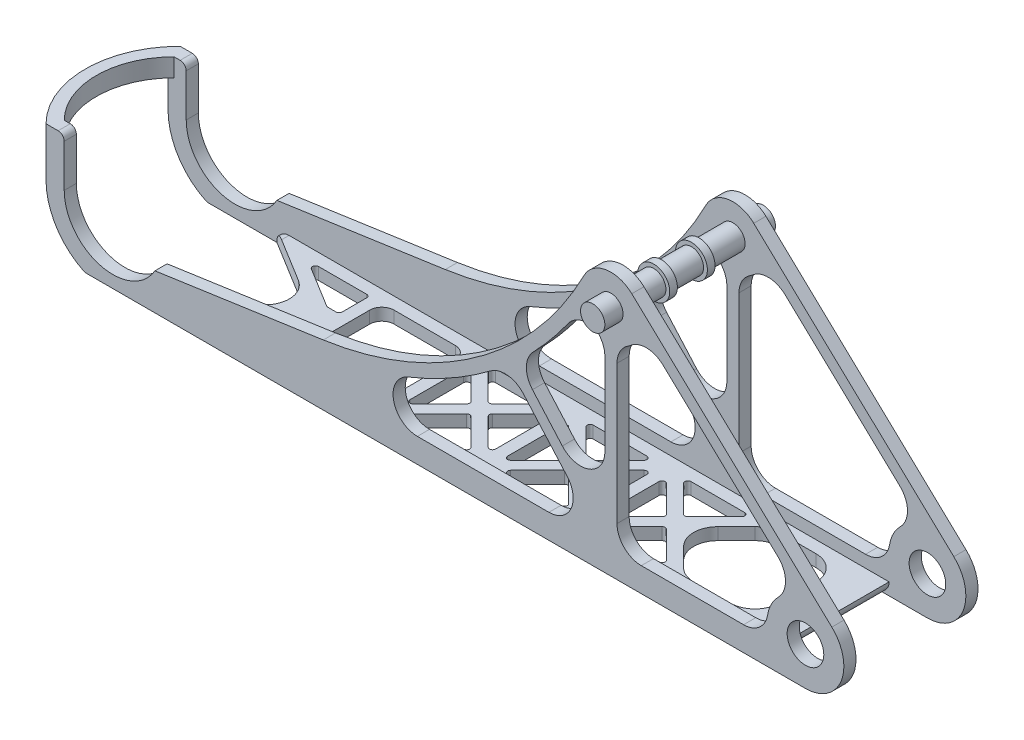
from build123d import *

# Parameters (mm, degrees)
SKETCH2_R            = 7.9375
SKETCH2_R_2          = 3.175
SKETCH2_R_3          = 10.033
BOSS_EXTRUDE1_DEPTH  = 3.175
SKETCH3_W            = 159.943477372
SKETCH3_H            = 3.175
BOSS_EXTRUDE2_DEPTH  = 17.526
FILLET1_R            = 3.175
CUT_EXTRUDE3_DEPTH   = 218.74804909
CUT_EXTRUDE2_DEPTH   = 222.832006327
FILLET5_START        = -17.526
FILLET5_DEPTH        = 3.175
FILLET5_START_2      = 14.351
FILLET5_2_DEPTH      = 3.175
SKETCH6_R            = 3.175
BOSS_EXTRUDE3_DEPTH  = 22.2885
BOSS_EXTRUDE4_DEPTH  = 3.175
FILLET6_R            = 1.5875
FILLET6_OF_MIRROR5_R = 1.5875
FILLET7_R            = 0.79375
FILLET8_R            = 0.79375
FILLET10_R           = 6.35
SKETCH9_W            = 1.5875
SKETCH9_H            = 3.175
BOSS_EXTRUDE5_DEPTH  = 4.7625
CUT_EXTRUDE4_DEPTH   = 219.183018218
SKETCH11_R           = 4.7879
CUT_EXTRUDE5_DEPTH   = 223.634208372
SKETCH12_R           = 4.175
SKETCH12_R_2         = 3.175
BOSS_EXTRUDE6_DEPTH  = 1
BOSS_EXTRUDE7_START  = -9.8425
SKETCH12_2_R         = 4.175
SKETCH12_2_R_2       = 3.175
BOSS_EXTRUDE7_DEPTH  = 1


with BuildPart() as part:
    # Sketch2 → Boss-Extrude1 (new body)
    # profile 1 of 3: a face of its own
    with BuildSketch(Plane.XY.offset(17.526)):
        with BuildLine():
            Line((203.734571541, 20.506202772), (151.468405055, 69.810144243))
            ThreePointArc((151.468405055, 69.810144243), (153.309984981, 67.180377869), (153.959250355, 64.036249645))
            ThreePointArc((153.959250355, 64.036249645), (144.157475429, 56.320785612), (138.959972181, 67.660500641))
            ThreePointArc((138.959972181, 67.660500641), (110.818436746, 35.084174324), (70.86761314, 19.05))
            Line((70.86761314, 19.05), (26.873522628, 12.7))
            ThreePointArc((26.873522628, 12.7), (12.587998127, 6.782742006), (3.175, 19.05))
            Line((3.175, 19.05), (3.175, 30.1625))
            ThreePointArc((3.175, 30.1625), (1.5875, 31.75), (0, 30.1625))
            Line((0, 30.1625), (0, 19.05))
            ThreePointArc((0, 19.05), (4.649679849, 7.824679849), (15.875, 3.175))
            Line((15.875, 3.175), (196.85, 3.175))
            ThreePointArc((196.85, 3.175), (187.525731733, 16.911931734), (203.734571541, 20.506202772))
        make_face()
    # profile 2 of 3: a face of its own
    with BuildSketch(Plane.XY.offset(17.526)):
        with Locations((146.021750355, 64.036249645)):
            Circle(SKETCH2_R)
        with Locations((146.021750355, 64.036249645)):
            Circle(SKETCH2_R_2, mode=Mode.SUBTRACT)
    # profile 3 of 3: a face of its own
    with BuildSketch(Plane.XY.offset(17.526)):
        with Locations((196.85, 13.208)):
            Circle(SKETCH2_R_3)
        with Locations((196.85, 13.208)):
            Circle(SKETCH2_R_2, mode=Mode.SUBTRACT)
    boss_extrude1 = extrude(amount=-BOSS_EXTRUDE1_DEPTH)

    # Sketch3 → Boss-Extrude2 (add)
    with BuildSketch(Plane.XY.offset(17.526)):
        with Locations((106.845261314, 4.7625)):
            Rectangle(SKETCH3_W, SKETCH3_H)
    boss_extrude2 = extrude(amount=-BOSS_EXTRUDE2_DEPTH)

    # Mirror1: Boss-Extrude1, Boss-Extrude2 across plane
    add(boss_extrude1.mirror(Plane.XY))
    add(boss_extrude2.mirror(Plane.XY))

    # Fillet1
    fillet1_edges = [part.edges().sort_by_distance(p)[0] for p in [
        (26.873522628, 6.35, 0),
        (186.817, 3.175, 0),
    ]]
    fillet(fillet1_edges, radius=FILLET1_R - 0.0001)  # a hair under: the kernel refuses the full size

    # Sketch4 → Cut-Extrude3 (cut, through all)
    with BuildSketch(Plane(origin=(0, 6.35, 0), x_dir=(1, 0, 0), z_dir=(0, 1, 0))):
        with BuildLine():
            Line((41.424338906, 5.410293046), (26.873522628, 14.351))
            Line((26.873522628, 14.351), (26.873522628, -14.351))
            Line((26.873522628, -14.351), (41.424338906, -5.410293046))
            ThreePointArc((41.424338906, -5.410293046), (44.45, 0), (41.424338906, 5.410293046))
        make_face()
        Polygon((51.126971921, -3.175), (38.105509342, -11.176), (54.301971921, -11.176), (54.301971921, -3.175), align=None)
        Polygon((54.301971921, 3.175), (54.301971921, 11.176), (38.105509342, 11.176), (51.126971921, 3.175), align=None)
        Polygon((68.652971921, -2.24506403), (59.722035952, -11.176), (77.583907891, -11.176), align=None)
        Polygon((57.476971921, 8.93093597), (57.476971921, -8.93093597), (66.407907891, 0), align=None)
        Polygon((79.828971921, 8.93093597), (70.898035952, 0), (79.828971921, -8.93093597), align=None)
        Polygon((59.722035952, 11.176), (68.652971921, 2.24506403), (77.583907891, 11.176), align=None)
        Polygon((94.179971921, -2.24506403), (85.249035952, -11.176), (103.110907891, -11.176), align=None)
        Polygon((83.003971921, 8.93093597), (83.003971921, -8.93093597), (91.934907891, 0), align=None)
        Polygon((105.355971921, 8.93093597), (96.425035952, 0), (105.355971921, -8.93093597), align=None)
        Polygon((85.249035952, 11.176), (94.179971921, 2.24506403), (103.110907891, 11.176), align=None)
        Polygon((119.706971921, -2.24506403), (110.776035952, -11.176), (128.637907891, -11.176), align=None)
        Polygon((108.530971921, 8.93093597), (108.530971921, -8.93093597), (117.461907891, 0), align=None)
        Polygon((130.882971921, 8.93093597), (121.952035952, 0), (130.882971921, -8.93093597), align=None)
        Polygon((110.776035952, 11.176), (119.706971921, 2.24506403), (128.637907891, 11.176), align=None)
        Polygon((145.233971921, -2.24506403), (136.303035952, -11.176), (154.164907891, -11.176), align=None)
        Polygon((134.057971921, 8.93093597), (134.057971921, -8.93093597), (142.988907891, 0), align=None)
        Polygon((158.655035952, 11.176), (147.479035952, 0), (158.655035952, -11.176), (177.292, -11.176), (177.292, 11.176), (161.830035952, 11.176), align=None)
        Polygon((136.303035952, 11.176), (145.233971921, 2.24506403), (154.164907891, 11.176), align=None)
    extrude(amount=-CUT_EXTRUDE3_DEPTH, mode=Mode.SUBTRACT)

    # Sketch5 → Cut-Extrude2 (cut, through all)
    with BuildSketch(Plane.XY.offset(17.526)):
        with BuildLine():
            Line((71.321184569, 15.907564963), (27.327094057, 9.557564963))
            Line((27.327094057, 9.557564963), (27.101477372, 9.525))
            Line((27.101477372, 9.525), (143.903046849, 9.525))
            Line((143.903046849, 9.525), (119.1289989, 37.554516736))
            ThreePointArc((119.1289989, 37.554516736), (96.760430289, 23.340208677), (71.321184569, 15.907564963))
        make_face()
        with BuildLine():
            ThreePointArc((138.776352339, 60.794627545), (130.910536695, 49.598167061), (121.507959659, 39.657174747))
            Line((121.507959659, 39.657174747), (144.434250355, 13.718222416))
            Line((144.434250355, 13.718222416), (144.434250355, 56.098749645))
            Line((144.434250355, 56.098749645), (144.434250355, 56.259119712))
            ThreePointArc((144.434250355, 56.259119712), (141.057102365, 57.843013287), (138.776352339, 60.794627545))
        make_face()
        with BuildLine():
            Line((147.609250355, 56.098749645), (147.609250355, 9.525))
            Line((147.609250355, 9.525), (187.51744408, 9.525))
            ThreePointArc((187.51744408, 9.525), (188.384235513, 18.592414607), (196.228885591, 23.221755833))
            Line((196.228885591, 23.221755833), (153.908858853, 63.143262644))
            ThreePointArc((153.908858853, 63.143262644), (151.877508848, 58.677705186), (147.609250355, 56.259119712))
            Line((147.609250355, 56.259119712), (147.609250355, 56.098749645))
        make_face()
    extrude(amount=-CUT_EXTRUDE2_DEPTH, mode=Mode.SUBTRACT)

    # Fillet5: read off the stored shape, not the designer's step
    # Fillet5 outline → Fillet5 (add)
    with BuildSketch(Plane.XY.offset(FILLET5_START)):
        with BuildLine():
            ThreePointArc((189.644321723, 29.433134501), (191.636406424, 24.900691806), (189.768781699, 20.315561914))
            ThreePointArc((189.768781699, 20.315561914), (192.733815715, 22.35776043), (196.228885591, 23.221755833))
            Line((196.228885591, 23.221755833), (189.644321723, 29.433134501))
        make_face()
        with BuildLine():
            ThreePointArc((187.51744408, 9.525), (186.873503206, 12.144702895), (186.95083395, 14.84127907))
            ThreePointArc((186.95083395, 14.84127907), (184.793967641, 11.033170392), (180.685538982, 9.525))
            Line((180.685538982, 9.525), (187.51744408, 9.525))
        make_face()
        with BuildLine():
            ThreePointArc((151.154709084, 57.981776842), (155.429422991, 59.485966656), (159.618399828, 57.757314277))
            Line((159.618399828, 57.757314277), (153.908858853, 63.143262644))
            ThreePointArc((153.908858853, 63.143262644), (153.024662005, 60.299521842), (151.154709084, 57.981776842))
        make_face()
        with BuildLine():
            Line((147.609250355, 9.525), (153.959250355, 9.525))
            ThreePointArc((153.959250355, 9.525), (149.469122294, 11.384871939), (147.609250355, 15.875))
            Line((147.609250355, 15.875), (147.609250355, 9.525))
        make_face()
        with BuildLine():
            ThreePointArc((147.609250355, 52.156487442), (148.359076746, 55.149906149), (150.431472577, 57.436381755))
            ThreePointArc((150.431472577, 57.436381755), (149.077589859, 56.710558471), (147.609250355, 56.259119712))
            Line((147.609250355, 56.259119712), (147.609250355, 52.156487442))
        make_face()
        with BuildLine():
            ThreePointArc((142.109076345, 57.068032591), (143.823594613, 54.873549731), (144.434250355, 52.156487442))
            Line((144.434250355, 52.156487442), (144.434250355, 56.259119712))
            ThreePointArc((144.434250355, 56.259119712), (141.057102365, 57.843013287), (138.776352339, 60.794627545))
            ThreePointArc((138.776352339, 60.794627545), (136.860812198, 57.732402808), (134.829468579, 54.745739541))
            ThreePointArc((134.829468579, 54.745739541), (138.080885233, 57.124349421), (142.109076345, 57.068032591))
        make_face()
        with BuildLine():
            Line((144.434250355, 13.718222416), (144.434250355, 30.491112082))
            ThreePointArc((144.434250355, 30.491112082), (140.33254953, 24.552454758), (133.326328838, 26.285796061))
            Line((133.326328838, 26.285796061), (144.434250355, 13.718222416))
        make_face()
        with BuildLine():
            ThreePointArc((125.514629062, 35.124003288), (123.924104407, 39.469787111), (125.705290835, 43.740967349))
            ThreePointArc((125.705290835, 43.740967349), (123.638316734, 41.666498466), (121.507959659, 39.657174747))
            Line((121.507959659, 39.657174747), (125.514629062, 35.124003288))
        make_face()
        with BuildLine():
            Line((143.903046849, 9.525), (134.573670689, 20.080316021))
            ThreePointArc((134.573670689, 20.080316021), (135.60480163, 13.265522728), (129.815749172, 9.525))
            Line((129.815749172, 9.525), (143.903046849, 9.525))
        make_face()
        with BuildLine():
            ThreePointArc((114.560542257, 33.890617868), (119.018173068, 35.133651766), (123.135668303, 33.021345277))
            Line((123.135668303, 33.021345277), (119.1289989, 37.554516736))
            ThreePointArc((119.1289989, 37.554516736), (116.873203561, 35.687114672), (114.560542257, 33.890617868))
        make_face()
        with BuildLine():
            Line((27.101477372, 9.525), (95.448030317, 9.525))
            ThreePointArc((95.448030317, 9.525), (89.21393407, 14.667298055), (93.076713731, 21.765616067))
            ThreePointArc((93.076713731, 21.765616067), (82.374433252, 18.184880685), (71.321184569, 15.907564963))
            Line((71.321184569, 15.907564963), (27.101477372, 9.525))
        make_face()
    extrude(amount=FILLET5_DEPTH)

    # Fillet5 2 outline → Fillet5 2 (add)
    with BuildSketch(Plane.XY.offset(FILLET5_START_2)):
        with BuildLine():
            ThreePointArc((189.644321723, 29.433134501), (191.636406424, 24.900691806), (189.768781699, 20.315561914))
            ThreePointArc((189.768781699, 20.315561914), (192.733815715, 22.35776043), (196.228885591, 23.221755833))
            Line((196.228885591, 23.221755833), (189.644321723, 29.433134501))
        make_face()
        with BuildLine():
            ThreePointArc((187.51744408, 9.525), (186.873503206, 12.144702895), (186.95083395, 14.84127907))
            ThreePointArc((186.95083395, 14.84127907), (184.793967641, 11.033170392), (180.685538982, 9.525))
            Line((180.685538982, 9.525), (187.51744408, 9.525))
        make_face()
        with BuildLine():
            ThreePointArc((151.154709084, 57.981776842), (155.429422991, 59.485966656), (159.618399828, 57.757314277))
            Line((159.618399828, 57.757314277), (153.908858853, 63.143262644))
            ThreePointArc((153.908858853, 63.143262644), (153.024662005, 60.299521842), (151.154709084, 57.981776842))
        make_face()
        with BuildLine():
            Line((147.609250355, 9.525), (153.959250355, 9.525))
            ThreePointArc((153.959250355, 9.525), (149.469122294, 11.384871939), (147.609250355, 15.875))
            Line((147.609250355, 15.875), (147.609250355, 9.525))
        make_face()
        with BuildLine():
            ThreePointArc((147.609250355, 52.156487442), (148.359076746, 55.149906149), (150.431472577, 57.436381755))
            ThreePointArc((150.431472577, 57.436381755), (149.077589859, 56.710558471), (147.609250355, 56.259119712))
            Line((147.609250355, 56.259119712), (147.609250355, 52.156487442))
        make_face()
        with BuildLine():
            ThreePointArc((142.109076345, 57.068032591), (143.823594613, 54.873549731), (144.434250355, 52.156487442))
            Line((144.434250355, 52.156487442), (144.434250355, 56.259119712))
            ThreePointArc((144.434250355, 56.259119712), (141.057102365, 57.843013287), (138.776352339, 60.794627545))
            ThreePointArc((138.776352339, 60.794627545), (136.860812198, 57.732402808), (134.829468579, 54.745739541))
            ThreePointArc((134.829468579, 54.745739541), (138.080885233, 57.124349421), (142.109076345, 57.068032591))
        make_face()
        with BuildLine():
            Line((144.434250355, 13.718222416), (144.434250355, 30.491112082))
            ThreePointArc((144.434250355, 30.491112082), (140.33254953, 24.552454758), (133.326328838, 26.285796061))
            Line((133.326328838, 26.285796061), (144.434250355, 13.718222416))
        make_face()
        with BuildLine():
            ThreePointArc((125.514629062, 35.124003288), (123.924104407, 39.469787111), (125.705290835, 43.740967349))
            ThreePointArc((125.705290835, 43.740967349), (123.638316734, 41.666498466), (121.507959659, 39.657174747))
            Line((121.507959659, 39.657174747), (125.514629062, 35.124003288))
        make_face()
        with BuildLine():
            Line((143.903046849, 9.525), (134.573670689, 20.080316021))
            ThreePointArc((134.573670689, 20.080316021), (135.60480163, 13.265522728), (129.815749172, 9.525))
            Line((129.815749172, 9.525), (143.903046849, 9.525))
        make_face()
        with BuildLine():
            ThreePointArc((114.560542257, 33.890617868), (119.018173068, 35.133651766), (123.135668303, 33.021345277))
            Line((123.135668303, 33.021345277), (119.1289989, 37.554516736))
            ThreePointArc((119.1289989, 37.554516736), (116.873203561, 35.687114672), (114.560542257, 33.890617868))
        make_face()
        with BuildLine():
            Line((27.101477372, 9.525), (95.448030317, 9.525))
            ThreePointArc((95.448030317, 9.525), (89.21393407, 14.667298055), (93.076713731, 21.765616067))
            ThreePointArc((93.076713731, 21.765616067), (82.374433252, 18.184880685), (71.321184569, 15.907564963))
            Line((71.321184569, 15.907564963), (27.101477372, 9.525))
        make_face()
    extrude(amount=FILLET5_2_DEPTH)

    # Sketch6 → Boss-Extrude3 (add)
    with BuildSketch(Plane.XY.offset(22.2885)):
        with Locations((146.021750355, 64.036249645)):
            Circle(SKETCH6_R)
    boss_extrude3 = extrude(amount=-BOSS_EXTRUDE3_DEPTH)

    # Mirror2: Boss-Extrude3 across plane
    add(boss_extrude3.mirror(Plane.XY))

    # Sketch8 → Boss-Extrude4 (add)
    with BuildSketch(Plane(origin=(0, 0, -17.526), x_dir=(-1, 0, 0), z_dir=(0, 0, -1))):
        with BuildLine():
            Line((-1.5875, 31.75), (1.5875, 31.75))
            Line((1.5875, 31.75), (1.5875, 30.1625))
            Line((1.5875, 30.1625), (1.5875, 19.05))
            ThreePointArc((1.5875, 19.05), (-1.178473526, 9.61861538), (-8.600161084, 3.175))
            Line((-8.600161084, 3.175), (-15.875, 3.175))
            ThreePointArc((-15.875, 3.175), (-4.649679849, 7.824679849), (0, 19.05))
            Line((0, 19.05), (0, 30.1625))
            ThreePointArc((0, 30.1625), (-0.464967985, 31.285032015), (-1.5875, 31.75))
        make_face()
    boss_extrude4 = extrude(amount=-BOSS_EXTRUDE4_DEPTH)

    # Fillet6
    fillet6_edges = [part.edges().sort_by_distance(p)[0] for p in [
        (-1.5875, 31.75, -15.9385),
        (8.600161084, 3.175, -15.9385),
    ]]
    fillet(fillet6_edges, radius=FILLET6_R)

    # Mirror5: Boss-Extrude4 across plane
    add(boss_extrude4.mirror(Plane.XY))

    # Fillet6 of Mirror5
    fillet6_of_mirror5_edges = [part.edges().sort_by_distance(p)[0] for p in [
        (-1.5875, 31.75, 15.9385),
        (8.600161084, 3.175, 15.9385),
    ]]
    fillet(fillet6_of_mirror5_edges, radius=FILLET6_OF_MIRROR5_R)

    # Fillet7
    fillet7_edges = [part.edges().sort_by_distance(p)[0] for p in [
        (51.126971921, 4.7625, 3.175),
        (54.301971921, 4.7625, 3.175),
        (54.301971921, 4.7625, 11.176),
        (38.105509342, 4.7625, 11.176),
        (54.301971921, 4.7625, -3.175),
        (51.126971921, 4.7625, -3.175),
        (38.105509342, 4.7625, -11.176),
        (54.301971921, 4.7625, -11.176),
    ]]
    fillet(fillet7_edges, radius=FILLET7_R)

    # Fillet8
    fillet8_edges = [part.edges().sort_by_distance(p)[0] for p in [
        (94.179971921, 4.7625, -2.24506403),
        (85.249035952, 4.7625, -11.176),
        (103.110907891, 4.7625, -11.176),
        (96.425035952, 4.7625, 0),
        (105.355971921, 4.7625, -8.93093597),
        (105.355971921, 4.7625, 8.93093597),
        (108.530971921, 4.7625, 8.93093597),
        (108.530971921, 4.7625, -8.93093597),
        (110.776035952, 4.7625, 11.176),
        (119.706971921, 4.7625, 2.24506403),
        (128.637907891, 4.7625, 11.176),
        (121.952035952, 4.7625, 0),
        (130.882971921, 4.7625, -8.93093597),
        (130.882971921, 4.7625, 8.93093597),
        (119.706971921, 4.7625, -2.24506403),
        (110.776035952, 4.7625, -11.176),
        (128.637907891, 4.7625, -11.176),
        (145.233971921, 4.7625, -2.24506403),
        (136.303035952, 4.7625, -11.176),
        (154.164907891, 4.7625, -11.176),
        (136.303035952, 4.7625, 11.176),
        (145.233971921, 4.7625, 2.24506403),
        (154.164907891, 4.7625, 11.176),
        (68.652971921, 4.7625, 2.24506403),
        (77.583907891, 4.7625, 11.176),
        (59.722035952, 4.7625, 11.176),
        (57.476971921, 4.7625, 8.93093597),
        (57.476971921, 4.7625, -8.93093597),
        (66.407907891, 4.7625, 0),
        (59.722035952, 4.7625, -11.176),
        (77.583907891, 4.7625, -11.176),
        (68.652971921, 4.7625, -2.24506403),
        (70.898035952, 4.7625, 0),
        (79.828971921, 4.7625, -8.93093597),
        (79.828971921, 4.7625, 8.93093597),
        (85.249035952, 4.7625, 11.176),
        (94.179971921, 4.7625, 2.24506403),
        (103.110907891, 4.7625, 11.176),
        (83.003971921, 4.7625, 8.93093597),
        (83.003971921, 4.7625, -8.93093597),
        (91.934907891, 4.7625, 0),
        (134.057971921, 4.7625, 8.93093597),
        (134.057971921, 4.7625, -8.93093597),
        (142.988907891, 4.7625, 0),
    ]]
    fillet(fillet8_edges, radius=FILLET8_R)

    # Fillet10
    fillet10_edges = [part.edges().sort_by_distance(p)[0] for p in [
        (147.479035952, 4.7625, 0),
        (158.655035952, 4.7625, -11.176),
        (177.292, 4.7625, -11.176),
        (177.292, 4.7625, 11.176),
        (158.655035952, 4.7625, 11.176),
    ]]
    fillet(fillet10_edges, radius=FILLET10_R)

    # Sketch9 → Boss-Extrude5 (add)
    with BuildSketch(Plane(origin=(0, 31.75, 0), x_dir=(1, 0, 0), z_dir=(0, 1, 0))):
        with BuildLine():
            Line((-1.5875, 17.526), (-1.5875, 14.351))
            Line((-1.5875, 14.351), (0, 14.351))
            ThreePointArc((0, 14.351), (-5.944378834, 0), (0, -14.351))
            Line((0, -14.351), (-1.5875, -14.351))
            Line((-1.5875, -14.351), (-1.5875, -17.526))
            ThreePointArc((-1.5875, -17.526), (-8.847006894, 0), (-1.5875, 17.526))
        make_face()
        with Locations((-0.79375, 15.9385)):
            Rectangle(SKETCH9_W, SKETCH9_H)
        with Locations((0.79375, 15.9385)):
            Rectangle(SKETCH9_W, SKETCH9_H)
        with Locations((0.79375, -15.9385)):
            Rectangle(SKETCH9_W, SKETCH9_H)
        with Locations((-0.79375, -15.9385)):
            Rectangle(SKETCH9_W, SKETCH9_H)
    extrude(amount=-BOSS_EXTRUDE5_DEPTH)

    # Sketch10 → Cut-Extrude4 (cut, through all)
    with BuildSketch(Plane(origin=(0, 6.35, 0), x_dir=(1, 0, 0), z_dir=(0, 1, 0))):
        with BuildLine():
            Line((76.653971921, 11.176), (60.651971921, 11.176))
            ThreePointArc((60.651971921, 11.176), (58.406907891, 10.24606403), (57.476971921, 8.001))
            Line((57.476971921, 8.001), (57.476971921, -8.001))
            ThreePointArc((57.476971921, -8.001), (58.406907891, -10.24606403), (60.651971921, -11.176))
            Line((60.651971921, -11.176), (76.653971921, -11.176))
            ThreePointArc((76.653971921, -11.176), (78.899035952, -10.24606403), (79.828971921, -8.001))
            Line((79.828971921, -8.001), (79.828971921, 8.001))
            ThreePointArc((79.828971921, 8.001), (78.899035952, 10.24606403), (76.653971921, 11.176))
        make_face()
    extrude(amount=-CUT_EXTRUDE4_DEPTH, mode=Mode.SUBTRACT)

    # Sketch11 → Cut-Extrude5 (cut, through all)
    with BuildSketch(Plane(origin=(0, 0, -17.526), x_dir=(-1, 0, 0), z_dir=(0, 0, -1))):
        with Locations((-196.85, 13.208)):
            Circle(SKETCH11_R)
    extrude(amount=-CUT_EXTRUDE5_DEPTH, mode=Mode.SUBTRACT)

    # Sketch12 → Boss-Extrude6 (add, symmetric)
    with BuildSketch(Plane(origin=(0, 0, -4.5085), x_dir=(-1, 0, 0), z_dir=(0, 0, -1))):
        with Locations((-146.021750355, 64.036249645)):
            Circle(SKETCH12_R)
        with Locations(Location((-146.021750355, 64.036249645, 0), (0, 0, 180))):
            Circle(SKETCH12_R_2, mode=Mode.SUBTRACT)
    extrude(amount=BOSS_EXTRUDE6_DEPTH, both=True)

    # Sketch12<2> → Boss-Extrude7 (add, symmetric)
    with BuildSketch(Plane(origin=(0, 0, -4.5085), x_dir=(-1, 0, 0), z_dir=(0, 0, -1)).offset(BOSS_EXTRUDE7_START)):
        with Locations((-146.021750355, 64.036249645)):
            Circle(SKETCH12_2_R)
        with Locations(Location((-146.021750355, 64.036249645, 0), (0, 0, 180))):
            Circle(SKETCH12_2_R_2, mode=Mode.SUBTRACT)
    extrude(amount=BOSS_EXTRUDE7_DEPTH, both=True)


solid = part.part
